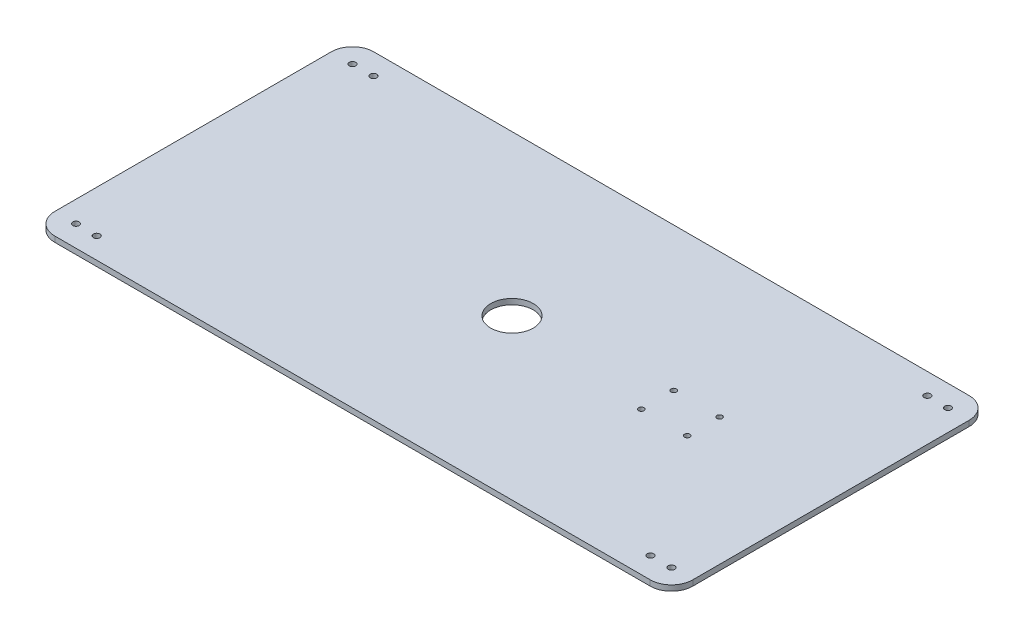
from build123d import *

# Parameters (mm, degrees)
SKETCH1_W               = 300
SKETCH1_H               = 150
BOSS_EXTRUDE1_DEPTH     = 2.6
FILLET1_R               = 10
SKETCH6_R               = 1.5
CUT_EXTRUDE6_DEPTH      = 2.6
MIRROR6_COPY_1_SKETCH_R = 1.5
MIRROR6_COPY_1_DEPTH    = 2.6
MIRROR6_COPY_2_SKETCH_R = 1.5
MIRROR6_COPY_2_DEPTH    = 2.6
SKETCH15_R              = 10
CUT_EXTRUDE14_DEPTH     = 336.420273687
SKETCH20_R              = 1.27
CUT_EXTRUDE15_DEPTH     = 336.420273687
SKETCH23_R              = 1.524
CUT_EXTRUDE16_DEPTH     = 2.59999988
MIRROR8_COPY_1_SKETCH_R = 1.524
MIRROR8_COPY_1_DEPTH    = 2.59999988
MIRROR8_COPY_2_SKETCH_R = 1.524
MIRROR8_COPY_2_DEPTH    = 2.59999988


with BuildPart() as part:
    # Sketch1 → Boss-Extrude1 (new body)
    with BuildSketch(Plane(origin=(0, 0, 0), x_dir=(1, 0, 0), z_dir=(0, 1, 0))):
        with Locations((150, -75)):
            Rectangle(SKETCH1_W, SKETCH1_H)
    extrude(amount=BOSS_EXTRUDE1_DEPTH)

    # Fillet1
    fillet1_edges = [part.edges().sort_by_distance(p)[0] for p in [
        (0, 1.3, 0),
        (0, 1.3, 150),
        (300, 1.3, 150),
        (300, 1.3, 0),
    ]]
    fillet(fillet1_edges, radius=FILLET1_R)

    # Sketch6 → Cut-Extrude6 (cut)
    with BuildSketch(Plane.XZ):
        with Locations((290, 10)):
            Circle(SKETCH6_R)
    cut_extrude6 = extrude(amount=-CUT_EXTRUDE6_DEPTH, mode=Mode.SUBTRACT)

    # Mirror5: Cut-Extrude6 across plane
    add(cut_extrude6.mirror(Plane(origin=(150, 0, 0), x_dir=(0, 0, 1), z_dir=(1, 0, 0))), mode=Mode.SUBTRACT)

    # Mirror6 copy 1 sketch → Mirror6 copy 1 (cut)
    with BuildSketch(Plane(origin=(300, 0, 150), x_dir=(-1, 0, 0), z_dir=(0, -1, 0))):
        with Locations((290, 10)):
            Circle(MIRROR6_COPY_1_SKETCH_R)
    extrude(amount=-MIRROR6_COPY_1_DEPTH, mode=Mode.SUBTRACT)

    # Mirror6 copy 2 sketch → Mirror6 copy 2 (cut)
    with BuildSketch(Plane(origin=(0, 0, 150), x_dir=(1, 0, 0), z_dir=(0, -1, 0))):
        with Locations((290, -10)):
            Circle(MIRROR6_COPY_2_SKETCH_R)
    extrude(amount=-MIRROR6_COPY_2_DEPTH, mode=Mode.SUBTRACT)

    # Sketch15 → Cut-Extrude14 (cut, through all)
    with BuildSketch(Plane.XZ):
        with Locations((150, 75)):
            Circle(SKETCH15_R)
    extrude(amount=-CUT_EXTRUDE14_DEPTH, mode=Mode.SUBTRACT)

    # Sketch20 → Cut-Extrude15 (cut, through all)
    with BuildSketch(Plane(origin=(0, 2.6, 0), x_dir=(1, 0, 0), z_dir=(0, 1, 0))):
        with Locations((218.41, -67.38)):
            Circle(SKETCH20_R)
        with Locations((240, -67.38)):
            Circle(SKETCH20_R)
        with Locations((218.41, -82.62)):
            Circle(SKETCH20_R)
        with Locations((240, -82.62)):
            Circle(SKETCH20_R)
    extrude(amount=-CUT_EXTRUDE15_DEPTH, mode=Mode.SUBTRACT)

    # Sketch23 → Cut-Extrude16 (cut)
    with BuildSketch(Plane(origin=(0, 2.6, 0), x_dir=(1, 0, 0), z_dir=(0, 1, 0))):
        with Locations((19.812, -9.906)):
            Circle(SKETCH23_R)
    cut_extrude16 = extrude(amount=-CUT_EXTRUDE16_DEPTH, mode=Mode.SUBTRACT)

    # Mirror7: Cut-Extrude16 across plane
    add(cut_extrude16.mirror(Plane(origin=(150, 0, 0), x_dir=(0, 0, 1), z_dir=(1, 0, 0))), mode=Mode.SUBTRACT)

    # Mirror8 copy 1 sketch → Mirror8 copy 1 (cut)
    with BuildSketch(Plane(origin=(300, 2.6, 150), x_dir=(-1, 0, 0), z_dir=(0, 1, 0))):
        with Locations((19.812, -9.906)):
            Circle(MIRROR8_COPY_1_SKETCH_R)
    extrude(amount=-MIRROR8_COPY_1_DEPTH, mode=Mode.SUBTRACT)

    # Mirror8 copy 2 sketch → Mirror8 copy 2 (cut)
    with BuildSketch(Plane(origin=(0, 2.6, 150), x_dir=(1, 0, 0), z_dir=(0, 1, 0))):
        with Locations((19.812, 9.906)):
            Circle(MIRROR8_COPY_2_SKETCH_R)
    extrude(amount=-MIRROR8_COPY_2_DEPTH, mode=Mode.SUBTRACT)


solid = part.part
